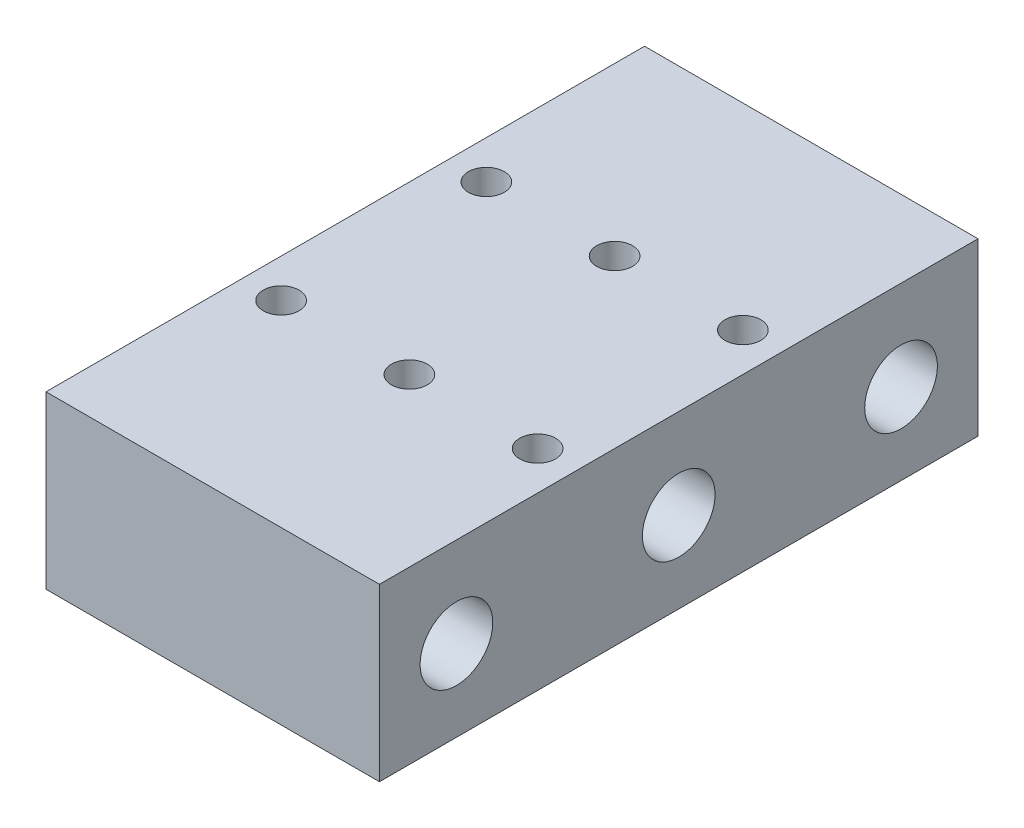
from build123d import *

# Parameters (mm, degrees)
ESBO_O1_W             = 39
ESBO_O1_H             = 70
FLANGE_BASE1_DEPTH    = 20
ESBO_O6_R             = 2.1
CORTE_EXTRUS_O1_DEPTH = 15
ESBO_O8_R             = 4.25
CORTE_EXTRUS_O2_DEPTH = 39


# Sheet-metal steps are written as plain solids
with BuildPart() as part:
    # Esboço1 → Flange-base1 (new body)
    with BuildSketch(Plane(origin=(0, 0, 0), x_dir=(1, 0, 0), z_dir=(0, 1, 0))):
        Rectangle(ESBO_O1_W, ESBO_O1_H)
    extrude(amount=-FLANGE_BASE1_DEPTH)

    # Esboço6 → Corte-extrusão1 (cut)
    with BuildSketch(Plane(origin=(0, 0, 0), x_dir=(1, 0, 0), z_dir=(0, 1, 0))):
        with Locations(Location((-15, 12, 0), (0, 0, 270))):
            Circle(ESBO_O6_R)
        with Locations(Location((15, 12, 0), (0, 0, 270))):
            Circle(ESBO_O6_R)
        with Locations(Location((0, 12, 0), (0, 0, 270))):
            Circle(ESBO_O6_R)
        with Locations(Location((-15, -12, 0), (0, 0, 270))):
            Circle(ESBO_O6_R)
        with Locations(Location((0, -12, 0), (0, 0, 270))):
            Circle(ESBO_O6_R)
        with Locations(Location((15, -12, 0), (0, 0, 270))):
            Circle(ESBO_O6_R)
    extrude(amount=-CORTE_EXTRUS_O1_DEPTH, mode=Mode.SUBTRACT)

    # Esboço8 → Corte-extrusão2 (cut)
    with BuildSketch(Plane.ZY.offset(19.5)):
        with Locations((-26, -10.5)):
            Circle(ESBO_O8_R)
        with Locations((26, -10.5)):
            Circle(ESBO_O8_R)
        with Locations((0, -10.5)):
            Circle(ESBO_O8_R)
    extrude(amount=-CORTE_EXTRUS_O2_DEPTH, mode=Mode.SUBTRACT)


solid = part.part
